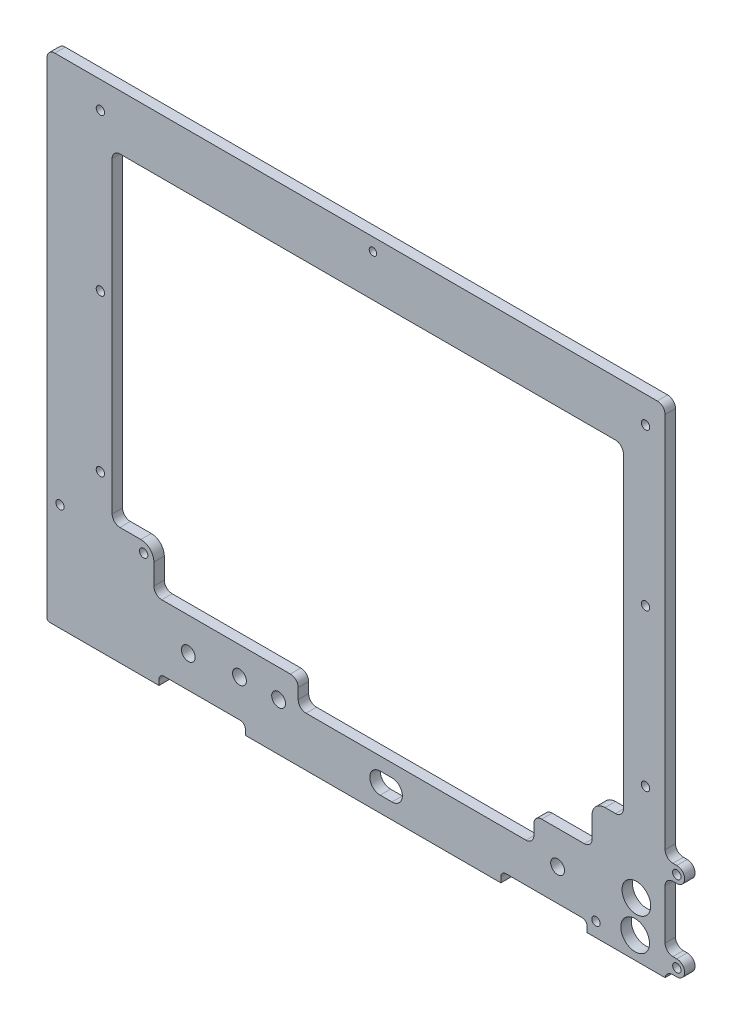
from build123d import *

# Parameters (mm, degrees)
RESSALTO_EXTRUS_O1_DEPTH = 4
FURO_COM_FOLGA_DE_M31_D  = 3.2
FILETE1_R                = 3
M3_CLEARANCE_HOLE1_D     = 3.2
FURO_COM_FOLGA_DE_M32_D  = 2.87
M3_CLEARANCE_HOLE2_D     = 3.2
SKETCH3_W                = 27.430623534
SKETCH3_H                = 190
CUT_EXTRUDE1_DEPTH       = 10
BOSS_EXTRUDE1_DEPTH      = 4
CUT_EXTRUDE3_DEPTH       = 10
FILLET2_R                = 3
FILLET3_R                = 3
SKETCH9_W                = 23.417498706
SKETCH9_H                = 10.613187714
SKETCH9_W_2              = 56.748489153
BOSS_EXTRUDE2_DEPTH      = 4
FILLET4_R                = 3
BOSS_EXTRUDE3_DEPTH      = 4
M3_CLEARANCE_HOLE4_D     = 3.2
FILLET5_R                = 3
M5_CLEARANCE_HOLE1_D     = 5.3
CUT_EXTRUDE4_DEPTH       = 215.251953603
CUT_EXTRUDE5_DEPTH       = 215.251953603
SKETCH15_R               = 5.5
CUT_EXTRUDE6_DEPTH       = 215.251953603
M5_CLEARANCE_HOLE2_D     = 5.3
FILLET6_R                = 3


# Some blends are built 0.0001 mm under size
with BuildPart() as part:
    # Esboço1 → Ressalto-extrusão1 (new body)
    with BuildSketch(Plane.XY):
        with BuildLine():
            Line((168.243612151, -138.115636704), (-79.756387849, -138.115636704))
            ThreePointArc((-79.756387849, -138.115636704), (-80.46349463, -137.822743485), (-80.756387849, -137.115636704))
            Line((-80.756387849, -137.115636704), (-80.756387849, 48.884363296))
            ThreePointArc((-80.756387849, 48.884363296), (-79.877708192, 51.005683639), (-77.756387849, 51.884363296))
            Line((-77.756387849, 51.884363296), (166.243612151, 51.884363296))
            ThreePointArc((166.243612151, 51.884363296), (168.364932495, 51.005683639), (169.243612151, 48.884363296))
            Line((169.243612151, 48.884363296), (169.243612151, -137.115636704))
            ThreePointArc((169.243612151, -137.115636704), (168.950718933, -137.822743485), (168.243612151, -138.115636704))
        make_face()
        with BuildLine():
            Line((-36.756387849, -93.115636704), (-55.756387849, -93.115636704))
            Line((-55.756387849, -93.115636704), (-55.756387849, -79.115636704))
            Line((-55.756387849, -79.115636704), (-55.756387849, 27.884363296))
            ThreePointArc((-55.756387849, 27.884363296), (-54.877708192, 30.005683639), (-52.756387849, 30.884363296))
            Line((-52.756387849, 30.884363296), (141.243612151, 30.884363296))
            ThreePointArc((141.243612151, 30.884363296), (143.364932495, 30.005683639), (144.243612151, 27.884363296))
            Line((144.243612151, 27.884363296), (144.243612151, -79.115636704))
            Line((144.243612151, -79.115636704), (144.243612151, -93.115636704))
            Line((144.243612151, -93.115636704), (125.243612151, -93.115636704))
            Line((125.243612151, -93.115636704), (125.243612151, -118.115636704))
            ThreePointArc((125.243612151, -118.115636704), (124.950718933, -118.822743485), (124.243612151, -119.115636704))
            Line((124.243612151, -119.115636704), (-35.756387849, -119.115636704))
            ThreePointArc((-35.756387849, -119.115636704), (-36.46349463, -118.822743485), (-36.756387849, -118.115636704))
            Line((-36.756387849, -118.115636704), (-36.756387849, -93.115636704))
        make_face(mode=Mode.SUBTRACT)
    extrude(amount=RESSALTO_EXTRUS_O1_DEPTH)

    # Furo com folga de M31 (through all)
    with Locations(Plane(origin=(0, 0, 0), x_dir=(-1, 0, 0), z_dir=(0, 0, -1))):
        with Locations((-148.743612151, -78.347886704), (-148.743612151, -18.347886704), (-148.743612151, 41.652113296), (60.256387849, 41.652113296), (60.256387849, -18.347886704), (60.256387849, -78.347886704)):
            Hole(FURO_COM_FOLGA_DE_M31_D / 2)

    # Filete1
    filete1_edges = [part.edges().sort_by_distance(p)[0] for p in [
        (-55.756387849, -93.115636704, 2),
        (-36.756387849, -93.115636704, 2),
        (125.243612151, -93.115636704, 2),
        (144.243612151, -93.115636704, 2),
    ]]
    fillet(filete1_edges, radius=FILETE1_R)

    # M3 Clearance Hole1 (through all)
    with Locations(Plane(origin=(0, 0, 0), x_dir=(-1, 0, 0), z_dir=(0, 0, -1))):
        with Locations((-164.230041881, -97.102981335), (43.669958119, -97.102981335), (75.742817578, -97.102981335)):
            Hole(M3_CLEARANCE_HOLE1_D / 2)

    # Furo com folga de M32 (through all)
    with Locations(Plane.XY.offset(4)):
        with Locations((44.243612151, 46.98714614)):
            Hole(FURO_COM_FOLGA_DE_M32_D / 2)

    # M3 Clearance Hole2 (through all)
    with Locations(Plane.XY.offset(4)):
        with Locations((161.560317261, 35.480164232), (161.560317261, 4.480164232)):
            Hole(M3_CLEARANCE_HOLE2_D / 2)

    # Sketch3 → Cut-Extrude1 (cut)
    with BuildSketch(Plane.XY.offset(4)):
        with Locations((169.958923918, -43.115636704)):
            Rectangle(SKETCH3_W, SKETCH3_H)
    extrude(amount=-CUT_EXTRUDE1_DEPTH, mode=Mode.SUBTRACT)

    # Sketch5 → Boss-Extrude1 (add)
    with BuildSketch(Plane(origin=(0, 0, 0), x_dir=(-1, 0, 0), z_dir=(0, 0, -1))):
        with BuildLine():
            Line((-145.240285588, -97.500155699), (-140.243612151, -97.500155699))
            Line((-140.243612151, -97.500155699), (-140.243612151, 27.941506315))
            ThreePointArc((-140.243612151, 27.941506315), (-139.345176367, 30.025791601), (-137.244155982, 30.884363296))
            Line((-137.244155982, 30.884363296), (-145.240285588, 30.884363296))
            Line((-145.240285588, 30.884363296), (-145.240285588, -97.500155699))
        make_face()
    extrude(amount=-BOSS_EXTRUDE1_DEPTH)

    # Sketch6 → Cut-Extrude3 (cut)
    with BuildSketch(Plane(origin=(0, 0, 0), x_dir=(-1, 0, 0), z_dir=(0, 0, -1))):
        with BuildLine():
            Line((-108.923612151, -113.115636704), (-128.243612151, -113.115636704))
            Line((-128.243612151, -113.115636704), (-128.243612151, -98.115636704))
            ThreePointArc((-128.243612151, -98.115636704), (-129.708078246, -94.580102798), (-133.243612151, -93.115636704))
            Line((-133.243612151, -93.115636704), (44.756387849, -93.115636704))
            ThreePointArc((44.756387849, -93.115636704), (41.220853943, -94.580102798), (39.756387849, -98.115636704))
            Line((39.756387849, -98.115636704), (39.756387849, -113.115636704))
            Line((39.756387849, -113.115636704), (20.436387849, -113.115636704))
            Line((20.436387849, -113.115636704), (20.436387849, -119.115636704))
            Line((20.436387849, -119.115636704), (-108.923612151, -119.115636704))
            Line((-108.923612151, -119.115636704), (-108.923612151, -113.115636704))
        make_face()
    extrude(amount=-CUT_EXTRUDE3_DEPTH, mode=Mode.SUBTRACT)

    # Fillet2
    fillet2_edges = [part.edges().sort_by_distance(p)[0] for p in [
        (-39.756387849, -113.115636704, 2),
        (128.243612151, -113.115636704, 2),
        (140.243612151, -93.115636704, 2),
    ]]
    fillet(fillet2_edges, radius=FILLET2_R - 0.0001)  # a hair under: the kernel refuses the full size

    # Fillet3
    fillet3_edges = [part.edges().sort_by_distance(p)[0] for p in [
        (156.243612151, 51.884363296, 2),
    ]]
    fillet(fillet3_edges, radius=FILLET3_R)

    # Sketch9 → Boss-Extrude2 (add)
    with BuildSketch(Plane(origin=(0, 0, 0), x_dir=(-1, 0, 0), z_dir=(0, 0, -1))):
        with Locations((-117.632361503, -114.422230557)):
            Rectangle(SKETCH9_W, SKETCH9_H)
        with Locations((12.794195261, -114.422230557)):
            Rectangle(SKETCH9_W_2, SKETCH9_H)
    extrude(amount=-BOSS_EXTRUDE2_DEPTH)

    # Fillet4
    fillet4_edges = [part.edges().sort_by_distance(p)[0] for p in [
        (105.92361215, -119.115636704, 2),
        (105.92361215, -109.1156367, 2),
        (15.580049316, -119.115636704, 2),
        (15.580049316, -109.1156367, 2),
    ]]
    fillet(fillet4_edges, radius=FILLET4_R)

    # Sketch10 → Boss-Extrude3 (add)
    with BuildSketch(Plane(origin=(0, 0, 0), x_dir=(-1, 0, 0), z_dir=(0, 0, -1))):
        with BuildLine():
            Line((-156.243612151, -135.615636704), (-160.743612151, -135.615636704))
            ThreePointArc((-160.743612151, -135.615636704), (-163.743612151, -132.615636704), (-160.743612151, -129.615636704))
            Line((-160.743612151, -129.615636704), (-156.243612151, -129.615636704))
            Line((-156.243612151, -129.615636704), (-156.243612151, -135.615636704))
        make_face()
        with BuildLine():
            Line((-156.243612151, -98.615636704), (-160.743612151, -98.615636704))
            ThreePointArc((-160.743612151, -98.615636704), (-163.743612151, -101.615636704), (-160.743612151, -104.615636704))
            Line((-160.743612151, -104.615636704), (-156.243612151, -104.615636704))
            Line((-156.243612151, -104.615636704), (-156.243612151, -98.615636704))
        make_face()
    extrude(amount=-BOSS_EXTRUDE3_DEPTH)

    # M3 Clearance Hole4 (through all)
    with Locations(Plane(origin=(0, 0, 0), x_dir=(-1, 0, 0), z_dir=(0, 0, -1))):
        with Locations((-160.743612151, -101.615636704), (-160.743612151, -132.615636704), (-129.743612151, -132.615636704)):
            Hole(M3_CLEARANCE_HOLE4_D / 2)

    # Fillet5
    # the kernel refuses this fillet: 3 mm, written as the material it adds along each edge
    with BuildSketch(Plane(origin=(156.243612151, -129.615636704, 0), x_dir=(0, 1, 0), z_dir=(0, 0, 1)), Plane(origin=(156.243612151, -98.615636704, 0), x_dir=(0, 1, 0), z_dir=(0, 0, 1)), Plane(origin=(156.243612151, -104.615636704, 0), x_dir=(1, 0, 0), z_dir=(0, 0, 1))) as fillet5_piece_1:
        with BuildLine():
            CenterArc((FILLET5_R, -FILLET5_R), FILLET5_R, 90, 90)
            Line((0, -FILLET5_R), (-FILLET5_R * 0.02, -FILLET5_R))
            Line((-FILLET5_R * 0.02, -FILLET5_R), (-FILLET5_R * 0.02, FILLET5_R * 0.02))
            Line((-FILLET5_R * 0.02, FILLET5_R * 0.02), (FILLET5_R, FILLET5_R * 0.02))
            Line((FILLET5_R, FILLET5_R * 0.02), (FILLET5_R, 0))
        make_face()
    extrude(amount=4)
    with BuildSketch(Plane(origin=(156.243612151, -135.615636704, 0), x_dir=(0, -1, 0), z_dir=(0, 0, 1))) as fillet5_piece_2:
        with BuildLine():
            CenterArc((3, 2.958039892), FILLET5_R, 180, 80.405931773)
            Line((0, 2.958039892), (-0.06, 2.958039892))
            Line((-0.06, 2.958039892), (-0.06, 0))
            Line((-0.06, 0), (0, -0.06))
            ThreePointArc((0, -0.06), (1.25, -0.06), (2.49, -0.059160798))
            Line((2.49, -0.059160798), (2.5, 0))
        make_face()
    extrude(amount=4)

    # M5 Clearance Hole1 (through all)
    with Locations(Plane(origin=(0, 0, 0), x_dir=(-1, 0, 0), z_dir=(0, 0, -1))):
        with Locations((-115.03361215, -121.8656367), (26.54638785, -121.8656367)):
            Hole(M5_CLEARANCE_HOLE1_D / 2)

    # Sketch13 → Cut-Extrude4 (cut, through all)
    with BuildSketch(Plane.XY.offset(4)):
        with BuildLine():
            Line((-4.670217718, -138.115636704), (-37.787747523, -138.115636704))
            Line((-37.787747523, -138.115636704), (-37.787747523, -136.092387065))
            ThreePointArc((-37.787747523, -136.092387065), (-37.201961086, -134.678173503), (-35.787747523, -134.092387065))
            Line((-35.787747523, -134.092387065), (-6.670217718, -134.092387065))
            ThreePointArc((-6.670217718, -134.092387065), (-5.256004156, -134.678173503), (-4.670217718, -136.092387065))
            Line((-4.670217718, -136.092387065), (-4.670217718, -138.115636704))
        make_face()
        with BuildLine():
            Line((126.398542328, -138.115636704), (93.281012523, -138.115636704))
            Line((93.281012523, -138.115636704), (93.281012523, -136.092387065))
            ThreePointArc((93.281012523, -136.092387065), (93.866798961, -134.678173503), (95.281012523, -134.092387065))
            Line((95.281012523, -134.092387065), (124.398542328, -134.092387065))
            ThreePointArc((124.398542328, -134.092387065), (125.812755891, -134.678173503), (126.398542328, -136.092387065))
            Line((126.398542328, -136.092387065), (126.398542328, -138.115636704))
        make_face()
    extrude(amount=-CUT_EXTRUDE4_DEPTH, mode=Mode.SUBTRACT)

    # Sketch14 → Cut-Extrude5 (cut, through all)
    with BuildSketch(Plane.XY.offset(4)):
        with BuildLine():
            Line((47.021220635, -124.115636704), (51.521220635, -124.115636704))
            ThreePointArc((51.521220635, -124.115636704), (55.521220635, -128.115636704), (51.521220635, -132.115636704))
            Line((51.521220635, -132.115636704), (47.021220635, -132.115636704))
            ThreePointArc((47.021220635, -132.115636704), (43.021220635, -128.115636704), (47.021220635, -124.115636704))
        make_face()
    extrude(amount=-CUT_EXTRUDE5_DEPTH, mode=Mode.SUBTRACT)

    # Sketch15 → Cut-Extrude6 (cut, through all)
    with BuildSketch(Plane(origin=(0, 0, 0), x_dir=(-1, 0, 0), z_dir=(0, 0, -1))):
        with Locations((-144.771180456, -129.756932302)):
            Circle(SKETCH15_R)
        with Locations((-145.243612151, -117.115636704)):
            Circle(SKETCH15_R)
    extrude(amount=-CUT_EXTRUDE6_DEPTH, mode=Mode.SUBTRACT)

    # M5 Clearance Hole2 (through all)
    with Locations(Plane.XY.offset(4)):
        with Locations((-6.93638785, -119.870636704), (8.06361215, -119.870636704)):
            Hole(M5_CLEARANCE_HOLE2_D / 2)

    # Fillet6
    fillet6_edges = [part.edges().sort_by_distance(p)[0] for p in [
        (128.243612151, -109.1156367, 2),
        (-39.756387849, -109.1156367, 2),
    ]]
    fillet(fillet6_edges, radius=FILLET6_R)


solid = part.part
